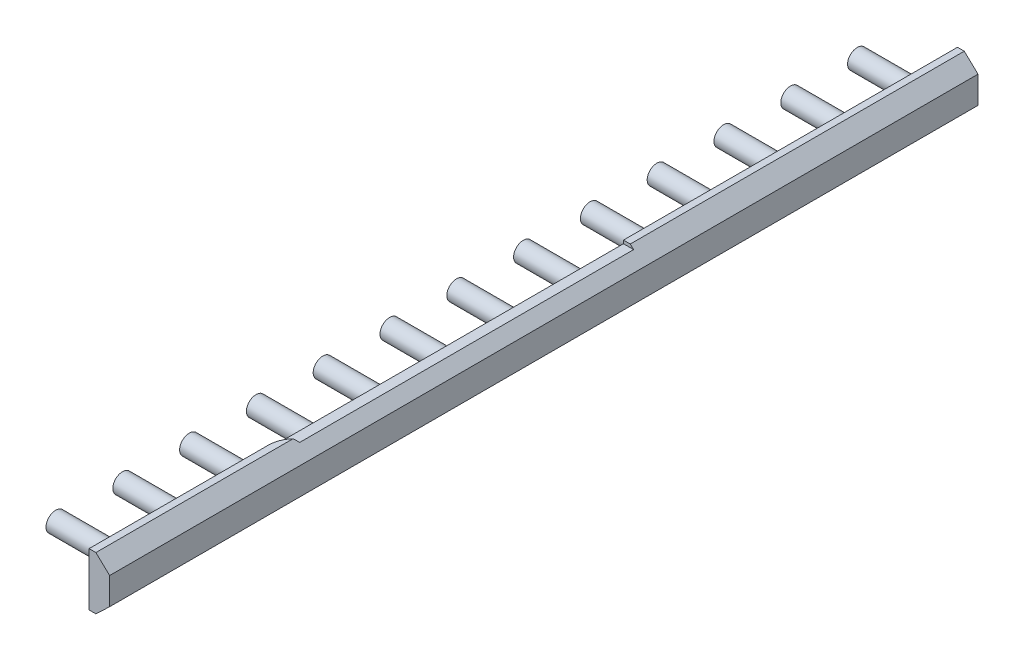
from build123d import *

# Parameters (mm, degrees)
BOSS_EXTRUDE1_DEPTH = 260
SKETCH2_R           = 2.9
BOSS_EXTRUDE2_DEPTH = 20
SKETCH3_W           = 100
SKETCH3_H           = 0.95
CUT_EXTRUDE1_DEPTH  = 261.889253324
CHAMFER1_SIZE       = 3
FILLET1_R           = 8


with BuildPart() as part:
    # Sketch1 → Boss-Extrude1 (new body)
    with BuildSketch(Plane.XY):
        Polygon((0, 7.95), (2.04, 7.95), (6.152414984, 4.048), (6.152414984, -4.048), (2.04, -7.95), (0, -7.95), align=None)
    extrude(amount=BOSS_EXTRUDE1_DEPTH)

    # Sketch2 → Boss-Extrude2 (add)
    with BuildSketch(Plane.ZY):
        with Locations((10, 0)):
            Circle(SKETCH2_R)
        with Locations((30, 0)):
            Circle(SKETCH2_R)
        with Locations((50, 0)):
            Circle(SKETCH2_R)
        with Locations((70, 0)):
            Circle(SKETCH2_R)
        with Locations((90, 0)):
            Circle(SKETCH2_R)
        with Locations((110, 0)):
            Circle(SKETCH2_R)
        with Locations((130, 0)):
            Circle(SKETCH2_R)
        with Locations((150, 0)):
            Circle(SKETCH2_R)
        with Locations((170, 0)):
            Circle(SKETCH2_R)
        with Locations((190, 0)):
            Circle(SKETCH2_R)
        with Locations((210, 0)):
            Circle(SKETCH2_R)
        with Locations((230, 0)):
            Circle(SKETCH2_R)
        with Locations((250, 0)):
            Circle(SKETCH2_R)
    extrude(amount=BOSS_EXTRUDE2_DEPTH)

    # Sketch3 → Cut-Extrude1 (cut, through all)
    with BuildSketch(Plane.ZY):
        with Locations((150, 7.475)):
            Rectangle(SKETCH3_W, SKETCH3_H)
    extrude(amount=-CUT_EXTRUDE1_DEPTH, mode=Mode.SUBTRACT)

    # Chamfer1
    chamfer1_edges = [part.edges().sort_by_distance(p)[0] for p in [
        (0, 7.475, 200),
    ]]
    chamfer(chamfer1_edges, length=CHAMFER1_SIZE)

    # Fillet1
    fillet1_edges = [part.edges().sort_by_distance(p)[0] for p in [
        (0, 7.475, 203),
    ]]
    fillet(fillet1_edges, radius=FILLET1_R)


solid = part.part
